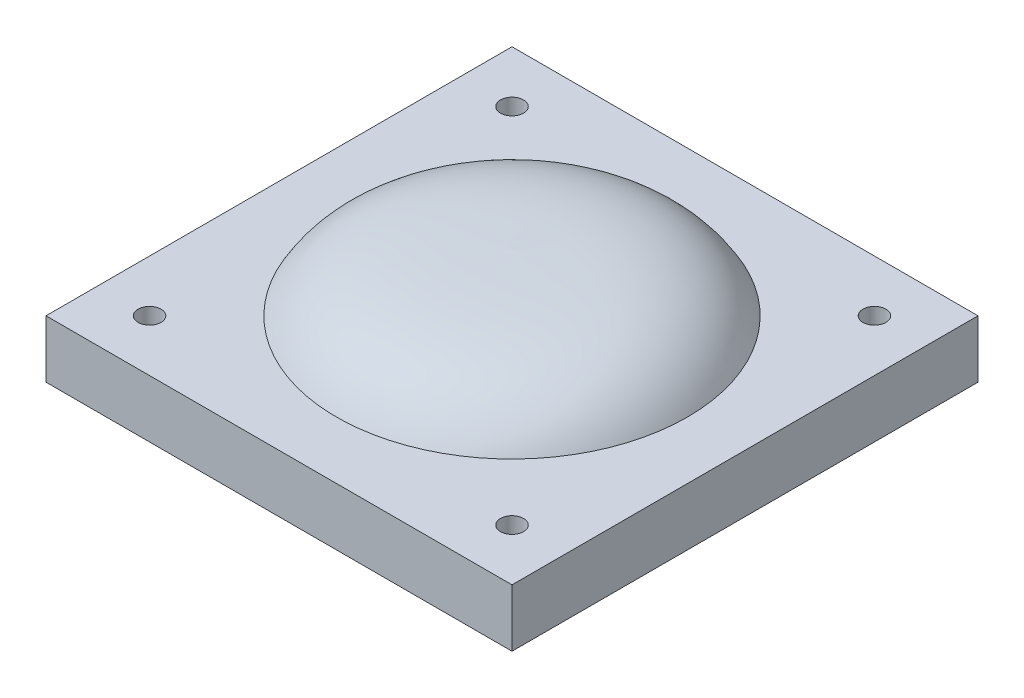
from build123d import *

# Parameters (mm, degrees)
SKETCH2_W           = 81
SKETCH2_H           = 81
BOSS_EXTRUDE1_DEPTH = 10
SKETCH3_R           = 2
CUT_EXTRUDE1_DEPTH  = 59.142067404


with BuildPart() as part:
    # Sketch1 → Revolve1 (revolve)
    with BuildSketch(Plane.XY):
        with BuildLine():
            Line((0, 10), (0, 0))
            Line((0, 0), (30.5, 0))
            add(Edge.make_bspline(
                [(30.5, 0), (24.462439427, 10.588096747), (11.157200838, 9.492825223), (0, 10)],
                knots=[0, 0, 0, 0, 1, 1, 1, 1], degree=3))
        make_face()
    revolve(axis=Axis((0, 10, 0), (0, -1, 0)))

    # Sketch2 → Boss-Extrude1 (add)
    with BuildSketch(Plane(origin=(0, 0, 0), x_dir=(1, 0, 0), z_dir=(0, 1, 0))):
        Rectangle(SKETCH2_W, SKETCH2_H)
    extrude(amount=-BOSS_EXTRUDE1_DEPTH)

    # Sketch3 → Cut-Extrude1 (cut, through all)
    with BuildSketch(Plane(origin=(0, 0, 0), x_dir=(1, 0, 0), z_dir=(0, 1, 0))):
        with Locations((-31.5, 31.5)):
            Circle(SKETCH3_R)
        with Locations((-31.5, -31.5)):
            Circle(SKETCH3_R)
        with Locations((31.5, -31.5)):
            Circle(SKETCH3_R)
        with Locations((31.5, 31.5)):
            Circle(SKETCH3_R)
    extrude(amount=-CUT_EXTRUDE1_DEPTH, mode=Mode.SUBTRACT)


solid = part.part
